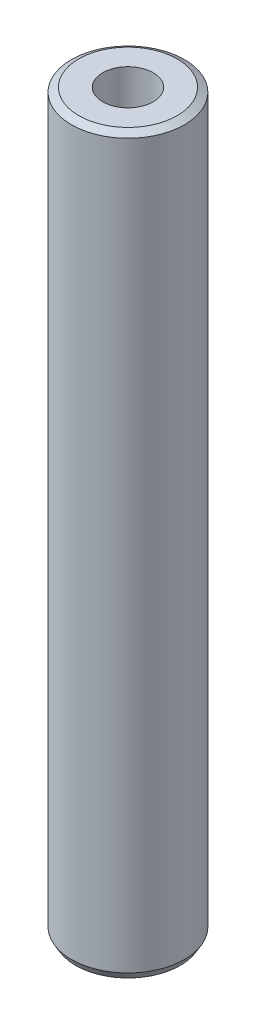
from build123d import *
from OCP.BRepFilletAPI import BRepFilletAPI_MakeChamfer

# Parameters (mm, degrees)
SKETCH1_R           = 40
BOSS_EXTRUDE1_DEPTH = 519.770944624
SKETCH2_R           = 17.857547049
CUT_EXTRUDE1_DEPTH  = 523.840161881
CHAMFER1_SIZE       = 2.988897139
CHAMFER1_SIZE2      = 5.176921703


with BuildPart() as part:
    # Sketch1 → Boss-Extrude1 (new body)
    with BuildSketch(Plane(origin=(0, 0, 0), x_dir=(1, 0, 0), z_dir=(0, 1, 0))):
        Circle(SKETCH1_R)
    extrude(amount=BOSS_EXTRUDE1_DEPTH)

    # Sketch2 → Cut-Extrude1 (cut, through all)
    with BuildSketch(Plane(origin=(0, 0, 0), x_dir=(1, 0, 0), z_dir=(0, 1, 0))):
        Circle(SKETCH2_R)
    extrude(amount=CUT_EXTRUDE1_DEPTH, mode=Mode.SUBTRACT)

    # Chamfer1: one chamfer whose edges measure the first distance from different faces: ONE call of the kernel's chamfer builder (chamfer() names one face for all edges)
    chamfer1_edges_1 = [part.edges().sort_by_distance(p)[0] for p in [
        (-40, 519.770944624, 0),
    ]]
    chamfer1_side_1 = [part.faces().sort_by_distance(p)[0] for p in [
        (-40, 259.885472312, 0),
    ]]
    chamfer1_edges_2 = [part.edges().sort_by_distance(p)[0] for p in [
        (-40, 0, 0),
    ]]
    chamfer1_side_2 = [part.faces().sort_by_distance(p)[0] for p in [
        (-38.86862915, 0, 0),
    ]]
    chamfer1 = BRepFilletAPI_MakeChamfer(part.part.solid().wrapped)
    for e in chamfer1_edges_1:
        chamfer1.Add(CHAMFER1_SIZE, CHAMFER1_SIZE2, e.wrapped, chamfer1_side_1[0].wrapped)  # the first distance lies on this face
    for e in chamfer1_edges_2:
        chamfer1.Add(CHAMFER1_SIZE, CHAMFER1_SIZE2, e.wrapped, chamfer1_side_2[0].wrapped)  # the first distance lies on this face
    add(Compound.cast(chamfer1.Shape()), mode=Mode.REPLACE)


solid = part.part
